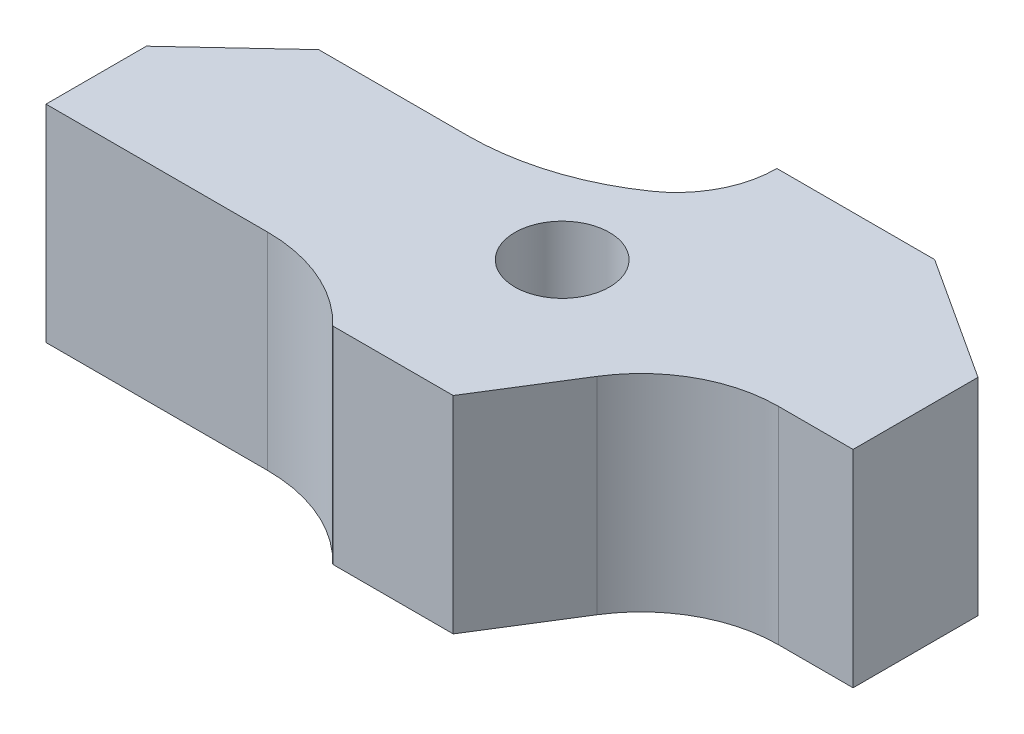
from build123d import *

# Parameters (mm, degrees)
SKETCH1_R           = 16.5
BOSS_EXTRUDE1_DEPTH = 72


with BuildPart() as part:
    # Sketch1 → Boss-Extrude1 (new body)
    with BuildSketch(Plane(origin=(0, 0, 0), x_dir=(1, 0, 0), z_dir=(0, 1, 0))):
        with BuildLine():
            Line((201.883781013, 108), (146.883781013, 108))
            ThreePointArc((146.883781013, 108), (142.874459509, 91.734150917), (131.765046934, 79.194874321))
            ThreePointArc((131.765046934, 79.194874321), (108.538764692, 67.886701787), (83, 64))
            Line((83, 64), (31.098692591, 64))
            Line((31.098692591, 64), (0, 35))
            Line((0, 35), (0, 0))
            Line((0, 0), (77.238209296, 0))
            ThreePointArc((77.238209296, 0), (98.859957606, -4.428268766), (117, -17))
            Line((117, -17), (159, -17))
            Line((159, -17), (178.293691384, 13.876360515))
            ThreePointArc((178.293691384, 13.876360515), (195.729138228, 30.421981775), (219, 36.440235832))
            Line((219, 36.440235832), (245, 36.440235832))
            Line((245, 36.440235832), (245, 80))
            Line((245, 80), (201.883781013, 108))
        make_face()
        with Locations((137, 43)):
            Circle(SKETCH1_R, mode=Mode.SUBTRACT)
    extrude(amount=BOSS_EXTRUDE1_DEPTH)


solid = part.part
